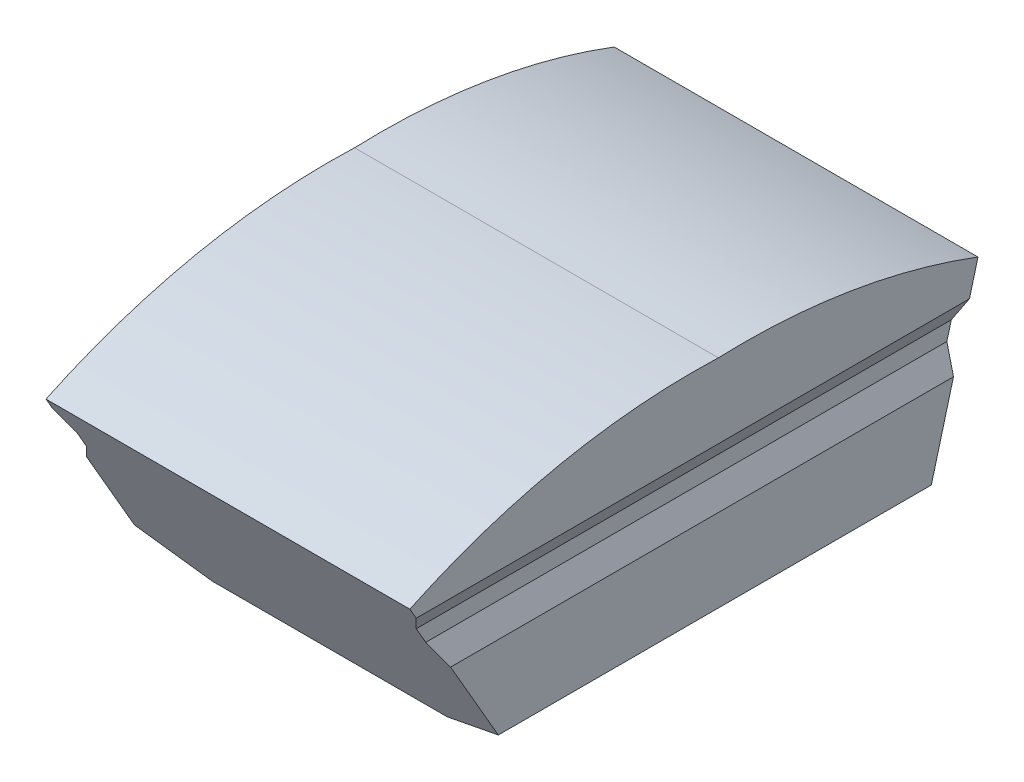
from build123d import *

# Parameters (mm, degrees)
BOSS_EXTRU_1_DEPTH      = 200
ENL_V_MAT_EXTRU_1_DEPTH = 274.130005675
SYM_TRIE2_COPY_1_DEPTH  = 200
SYM_TRIE2_COPY_2_DEPTH  = 274.130005675
SYM_TRIE2_COPY_3_DEPTH  = 274.130005675
INTERSECT1_START        = -110
INTERSECT1_DEPTH        = 220


# Read off the part's stored shape, not the designer's step: Intersect1
with BuildPart() as part:
    # Esquisse1 → Boss.-Extru.1 (new body)
    with BuildSketch(Plane.XY):
        Polygon((0, 0), (0, 150), (110, 150), (110, 100), (102.516685226, 87), (102.516685226, 77), (110, 64), (110, 14), (71, 0), align=None)
    boss_extru_1 = extrude(amount=BOSS_EXTRU_1_DEPTH)

    # Esquisse5 → Enlèv. mat.-Extru.1 (cut, symmetric)
    with BuildSketch(Plane(origin=(0, 0, 0), x_dir=(0, 0, -1), z_dir=(1, 0, 0))):
        with BuildLine():
            Line((0, 150), (-200, 150))
            Line((-200, 150), (-200, 100))
            ThreePointArc((-200, 100), (-102.931757397, 135.530032876), (0, 145))
            Line((0, 145), (0, 150))
        make_face()
    enl_v_mat_extru_1 = extrude(amount=ENL_V_MAT_EXTRU_1_DEPTH, both=True, mode=Mode.SUBTRACT)

    # Symétrie1: Boss.-Extru.1, Enlèv. mat.-Extru.1 across plane
    add(boss_extru_1.mirror(Plane.XY))
    add(enl_v_mat_extru_1.mirror(Plane.XY), mode=Mode.SUBTRACT)

    # Symétrie2: Boss.-Extru.1 across plane
    add(boss_extru_1.mirror(Plane(origin=(0, 0, 0), x_dir=(0, 0, 1), z_dir=(1, 0, 0))))

    # Symétrie2 copy 1 sketch → Symétrie2 copy 1 (add)
    with BuildSketch(Plane(origin=(0, 0, 0), x_dir=(-1, 0, 0), z_dir=(0, 0, -1))):
        Polygon((0, 0), (0, 150), (110, 150), (110, 100), (102.516685226, 87), (102.516685226, 77), (110, 64), (110, 14), (71, 0), align=None)
    extrude(amount=SYM_TRIE2_COPY_1_DEPTH)

    # Symétrie2 copy 2 sketch → Symétrie2 copy 2 (cut, symmetric)
    with BuildSketch(Plane.ZY):
        with BuildLine():
            Line((0, 150), (-200, 150))
            Line((-200, 150), (-200, 100))
            ThreePointArc((-200, 100), (-102.931757397, 135.530032876), (0, 145))
            Line((0, 145), (0, 150))
        make_face()
    extrude(amount=SYM_TRIE2_COPY_2_DEPTH, both=True, mode=Mode.SUBTRACT)

    # Symétrie2 copy 3 sketch → Symétrie2 copy 3 (cut, symmetric)
    with BuildSketch(Plane(origin=(0, 0, 0), x_dir=(0, 0, -1), z_dir=(-1, 0, 0))):
        with BuildLine():
            Line((0, -150), (-200, -150))
            Line((-200, -150), (-200, -100))
            ThreePointArc((-200, -100), (-102.931757397, -135.530032876), (0, -145))
            Line((0, -145), (0, -150))
        make_face()
    extrude(amount=SYM_TRIE2_COPY_3_DEPTH, both=True, mode=Mode.SUBTRACT)

    # Intersect1 outline → Intersect1 (cut)
    with BuildSketch(Plane.YZ.offset(INTERSECT1_START)):
        with BuildLine():
            ThreePointArc((100, -200), (110.281899779, -178.766997787), (119.294166687, -156.964775625))
            Line((119.294166687, -156.964775625), (0, -125))
            Line((0, -125), (0, -200))
            Line((0, -200), (100, -200))
        make_face()
        with BuildLine():
            Line((0, 200), (0, 125))
            Line((0, 125), (106.673784722, 186.588138325))
            ThreePointArc((106.673784722, 186.588138325), (103.399684527, 193.325314743), (100, 200))
            Line((100, 200), (0, 200))
        make_face()
    extrude(amount=INTERSECT1_DEPTH, mode=Mode.SUBTRACT)


solid = part.part
